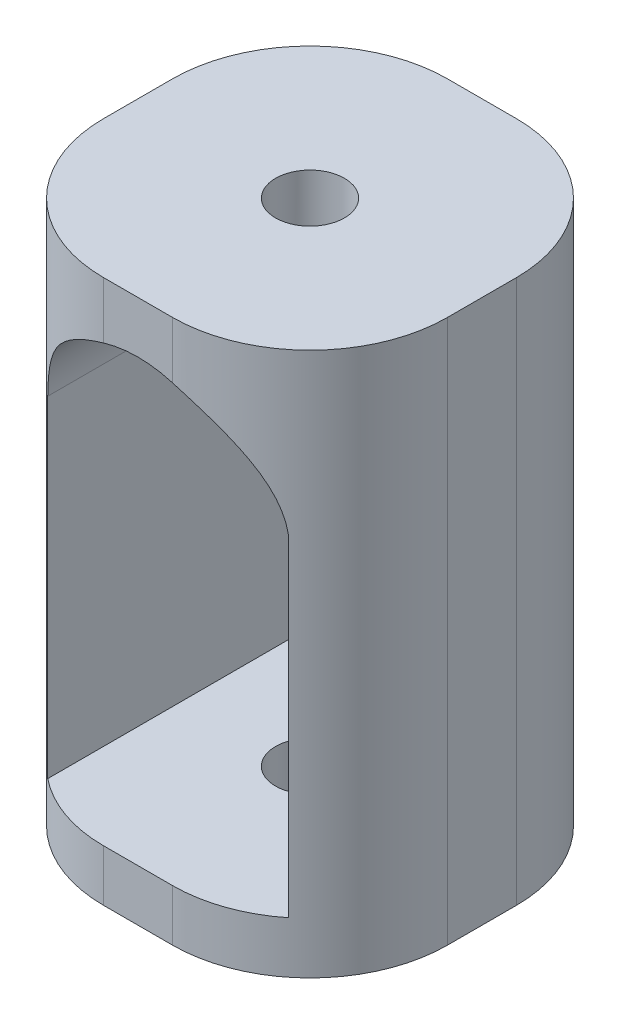
from build123d import *

# Parameters (mm, degrees)
CROQUIS1_W              = 20
CROQUIS1_H              = 20
SALIENTE_EXTRUIR1_DEPTH = 30
CROQUIS3_R              = 6.35
CORTAR_EXTRUIR1_DEPTH   = 18
CORTAR_EXTRUIR2_REACH   = 43.231
CROQUIS4_R              = 2
CROQUIS7_W              = 20
CROQUIS7_H              = 20
CROQUIS7_R              = 2
SALIENTE_EXTRUIR3_DEPTH = 1.6
CORTAR_EXTRUIR3_REACH   = 43.231
REDONDEO1_R             = 8


with BuildPart() as part:
    # Croquis1 → Saliente-Extruir1 (new body)
    with BuildSketch(Plane(origin=(0, 0, 0), x_dir=(1, 0, 0), z_dir=(0, 1, 0))):
        with Locations((-10, -10)):
            Rectangle(CROQUIS1_W, CROQUIS1_H)
    extrude(amount=SALIENTE_EXTRUIR1_DEPTH)

    # Croquis3 → Cortar-Extruir1 (cut)
    with BuildSketch(Plane.XY.offset(20)):
        with Locations((-10, 13.75)):
            Circle(CROQUIS3_R)
    extrude(amount=-CORTAR_EXTRUIR1_DEPTH, mode=Mode.SUBTRACT)

    # Cortar-Extruir2: up to this face of the body (flat: up to its plane)
    cortar_extruir2_end = Plane(part.part.faces().sort_by_distance((-10, 0, 10))[0])
    # Croquis4 → Cortar-Extruir2 (cut, up to the picked face)
    with BuildSketch(Plane(origin=(0, 30, 0), x_dir=(1, 0, 0), z_dir=(0, 1, 0)), mode=Mode.PRIVATE) as cortar_extruir2_sk1:
        with Locations(Location((-10, -10, 0), (0, 0, 270))):
            Circle(CROQUIS4_R)
    cortar_extruir2_tool1 = split(extrude(cortar_extruir2_sk1.sketch, amount=-CORTAR_EXTRUIR2_REACH, mode=Mode.PRIVATE), bisect_by=cortar_extruir2_end, keep=Keep.BOTH, mode=Mode.PRIVATE)
    add(cortar_extruir2_tool1.solids().sort_by(Axis((-10, 30, 10), (0, -1, 0)))[0], mode=Mode.SUBTRACT)

    # Croquis7 → Saliente-Extruir3 (add)
    with BuildSketch(Plane.XZ):
        with Locations((-10, 10)):
            Rectangle(CROQUIS7_W, CROQUIS7_H)
        with Locations(Location((-10, 10, 0), (0, 0, 90))):
            Circle(CROQUIS7_R, mode=Mode.SUBTRACT)
    extrude(amount=SALIENTE_EXTRUIR3_DEPTH)

    # Croquis8 → Cortar-Extruir3 (cut, up to next)
    with BuildSketch(Plane.XY.offset(20), mode=Mode.PRIVATE) as cortar_extruir3_sk1:
        with BuildLine():
            Line((-17, 7.75), (-17, 1.4))
            Line((-17, 1.4), (-3, 1.4))
            Line((-3, 1.4), (-3, 7.75))
            Line((-3, 7.75), (-3, 20.65))
            ThreePointArc((-3, 20.65), (-10, 27), (-17, 20.65))
            Line((-17, 20.65), (-17, 7.75))
        make_face()
    cortar_extruir3_tool1 = extrude(cortar_extruir3_sk1.sketch, amount=-CORTAR_EXTRUIR3_REACH, mode=Mode.PRIVATE) & part.part
    add(cortar_extruir3_tool1.solids().sort_by_distance((-10, 13.506159, 20))[0], mode=Mode.SUBTRACT)

    # Redondeo1
    # the kernel refuses this fillet: 8 mm, written as the material it takes off along each edge
    with BuildSketch(Plane(origin=(-20, -21.6, 0), x_dir=(1, 0, 0), z_dir=(0, 1, 0)), Plane(origin=(0, 50, 0), x_dir=(-1, 0, 0), z_dir=(0, -1, 0)), Plane(origin=(-20, -21.6, 20), x_dir=(0, 0, -1), z_dir=(0, 1, 0)), Plane(origin=(0, 50, 20), x_dir=(0, 0, -1), z_dir=(0, -1, 0))) as redondeo1_piece_1:
        with BuildLine():
            CenterArc((REDONDEO1_R, -REDONDEO1_R), REDONDEO1_R, 90, 90)
            Line((0, -REDONDEO1_R), (0, 0))
            Line((0, 0), (REDONDEO1_R, 0))
        make_face()
    extrude(amount=71.6, mode=Mode.SUBTRACT)


solid = part.part
